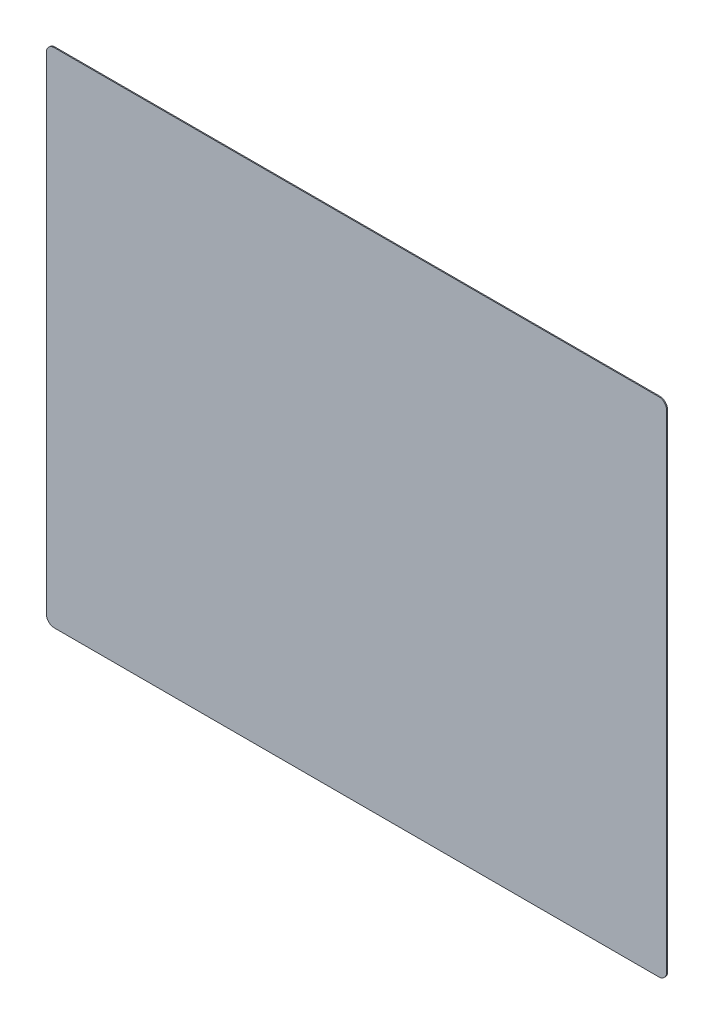
from build123d import *

# Parameters (mm, degrees)
SKETCH1_W           = 1003.3
SKETCH1_H           = 812.8
BOSS_EXTRUDE1_DEPTH = 1.5875
FILLET1_R           = 12.7


with BuildPart() as part:
    # Sketch1 → Boss-Extrude1 (new body)
    with BuildSketch(Plane.XY):
        Rectangle(SKETCH1_W, SKETCH1_H)
    extrude(amount=BOSS_EXTRUDE1_DEPTH)

    # Fillet1
    fillet1_edges = [part.edges().sort_by_distance(p)[0] for p in [
        (501.65, -406.4, 0.79375),
        (501.65, 406.4, 0.79375),
        (-501.65, -406.4, 0.79375),
        (-501.65, 406.4, 0.79375),
    ]]
    fillet(fillet1_edges, radius=FILLET1_R)


solid = part.part
